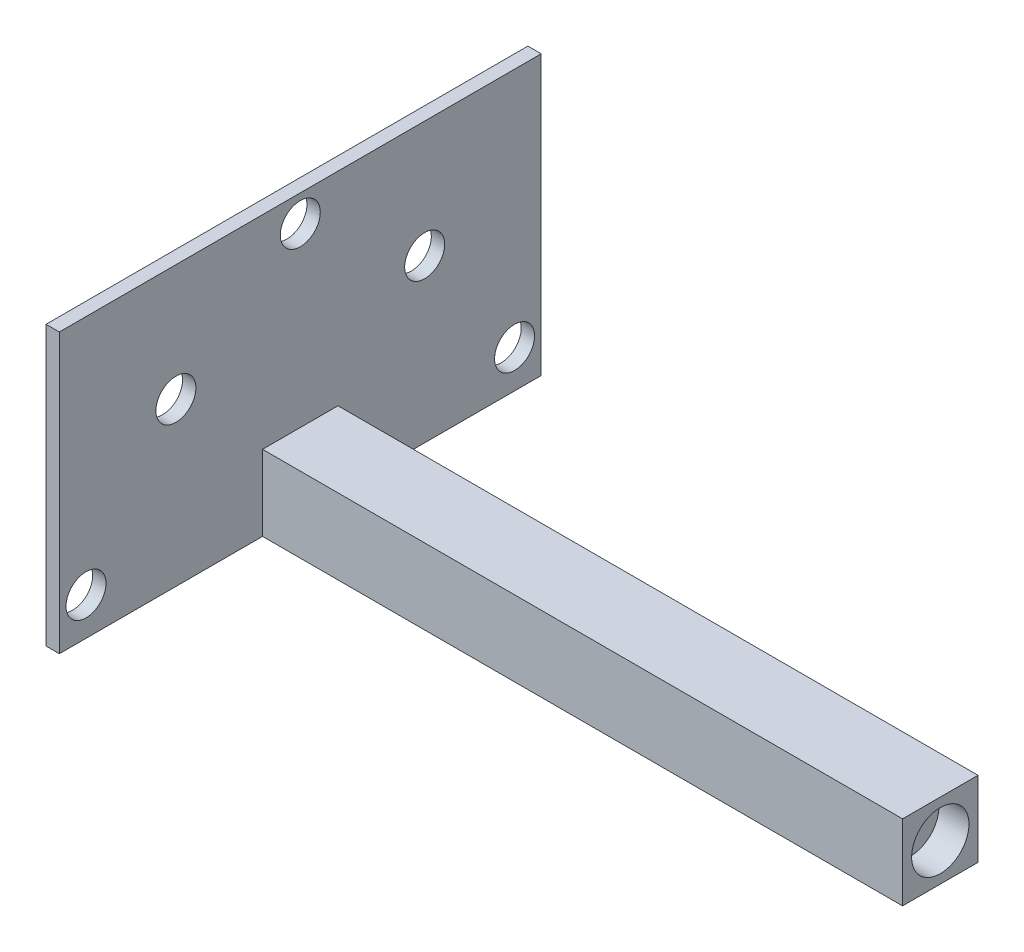
from build123d import *

# Parameters (mm, degrees)
SKETCH1_W           = 36.14155313
SKETCH1_H           = 20.89920369
SKETCH1_R           = 1.5
BOSS_EXTRUDE1_DEPTH = 1
SKETCH1_3_W         = 5.65685425
SKETCH1_3_H         = 5.65685425
BOSS_EXTRUDE2_DEPTH = 49
SKETCH3_R           = 2.15
CUT_EXTRUDE1_DEPTH  = 2.25


with BuildPart() as part:
    # Sketch1 → Boss-Extrude1 (new body)
    with BuildSketch(Plane(origin=(0, 0, 0), x_dir=(0, 0, -1), z_dir=(1, 0, 0))):
        with Locations((0, 7.62117472)):
            Rectangle(SKETCH1_W, SKETCH1_H)
        with Locations((-16.070776565, 0)):
            Circle(SKETCH1_R, mode=Mode.SUBTRACT)
        with Locations((16.070776565, 0)):
            Circle(SKETCH1_R, mode=Mode.SUBTRACT)
        with Locations((-9.328188773, 9.328188773)):
            Circle(SKETCH1_R, mode=Mode.SUBTRACT)
        with Locations((9.328188773, 9.328188773)):
            Circle(SKETCH1_R, mode=Mode.SUBTRACT)
        with Locations((0, 16.070776565)):
            Circle(SKETCH1_R, mode=Mode.SUBTRACT)
    extrude(amount=BOSS_EXTRUDE1_DEPTH)

    # Sketch1<3> → Boss-Extrude2 (add)
    with BuildSketch(Plane(origin=(0, 0, 0), x_dir=(0, 0, -1), z_dir=(1, 0, 0))):
        Rectangle(SKETCH1_3_W, SKETCH1_3_H)
    extrude(amount=BOSS_EXTRUDE2_DEPTH)

    # Sketch3 → Cut-Extrude1 (cut)
    with BuildSketch(Plane(origin=(49, 0, 0), x_dir=(0, 0, -1), z_dir=(1, 0, 0))):
        Circle(SKETCH3_R)
    extrude(amount=-CUT_EXTRUDE1_DEPTH, mode=Mode.SUBTRACT)


solid = part.part
